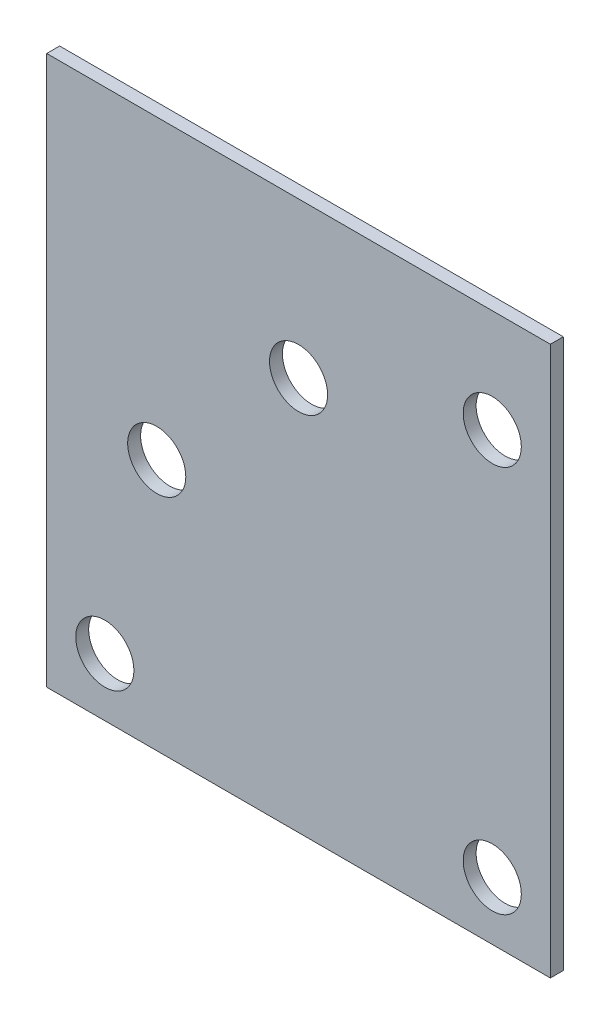
from build123d import *

# Parameters (mm, degrees)
SKETCH1_W                      = 247.65
SKETCH1_H                      = 269.875
SKETCH1_R                      = 14.2875
I_CAN_CHANGE_THESE_NAMES_DEPTH = 6.35


with BuildPart() as part:
    # Sketch1 → I CAN CHANGE THESE NAMES?! (new body)
    with BuildSketch(Plane.XY):
        with Locations((-95.25, 106.3625)):
            Rectangle(SKETCH1_W, SKETCH1_H)
        Circle(SKETCH1_R, mode=Mode.SUBTRACT)
        with Locations((-190.5, 0)):
            Circle(SKETCH1_R, mode=Mode.SUBTRACT)
        with Locations((-164.977839421, 95.25)):
            Circle(SKETCH1_R, mode=Mode.SUBTRACT)
        with Locations((-95.25, 164.977839421)):
            Circle(SKETCH1_R, mode=Mode.SUBTRACT)
        with Locations((0, 190.5)):
            Circle(SKETCH1_R, mode=Mode.SUBTRACT)
    extrude(amount=I_CAN_CHANGE_THESE_NAMES_DEPTH)


solid = part.part
